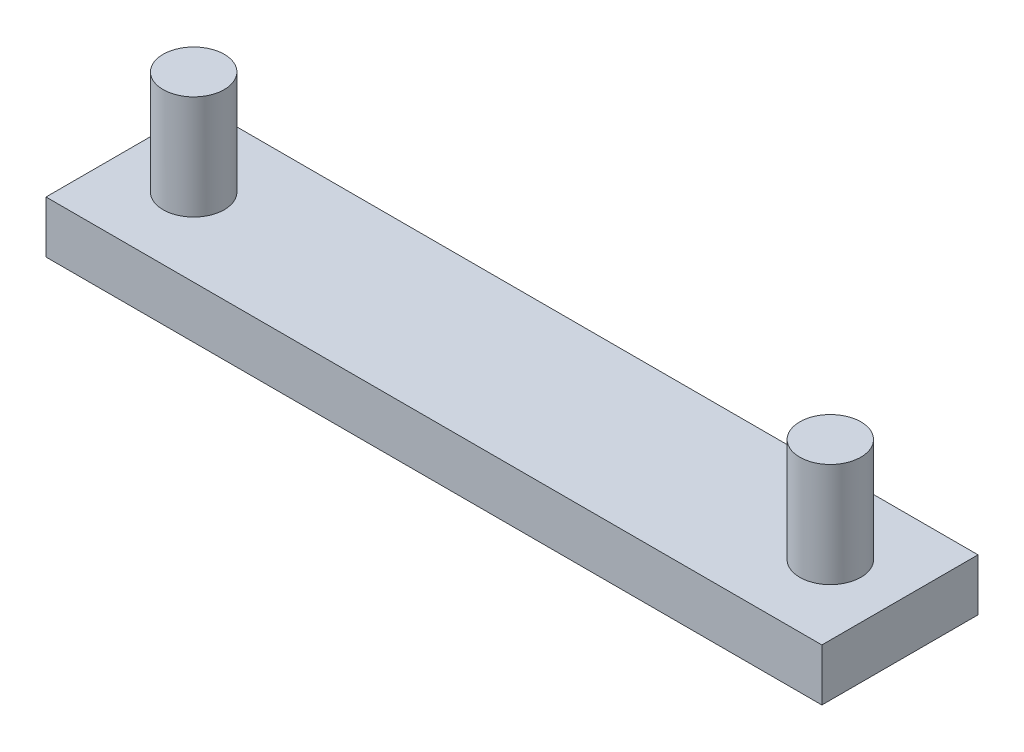
from build123d import *

# Parameters (mm, degrees)
SKETCH1_W           = 757.39
SKETCH1_H           = 152.4
SKETCH1_R           = 29.86
BOSS_EXTRUDE1_DEPTH = 50.8
SKETCH2_R           = 29.86
BOSS_EXTRUDE2_DEPTH = 152.4


with BuildPart() as part:
    # Sketch1 → Boss-Extrude1 (new body)
    with BuildSketch(Plane(origin=(0, 0, 0), x_dir=(1, 0, 0), z_dir=(0, 1, 0))):
        with Locations((-310.735, 0)):
            Rectangle(SKETCH1_W, SKETCH1_H)
        Circle(SKETCH1_R, mode=Mode.SUBTRACT)
        with Locations((-621.47, 0)):
            Circle(SKETCH1_R, mode=Mode.SUBTRACT)
    extrude(amount=BOSS_EXTRUDE1_DEPTH)

    # Sketch2 → Boss-Extrude2 (add)
    with BuildSketch(Plane.XZ):
        Circle(SKETCH2_R)
        with Locations((-621.47, 0)):
            Circle(SKETCH2_R)
    extrude(amount=-BOSS_EXTRUDE2_DEPTH)


solid = part.part
